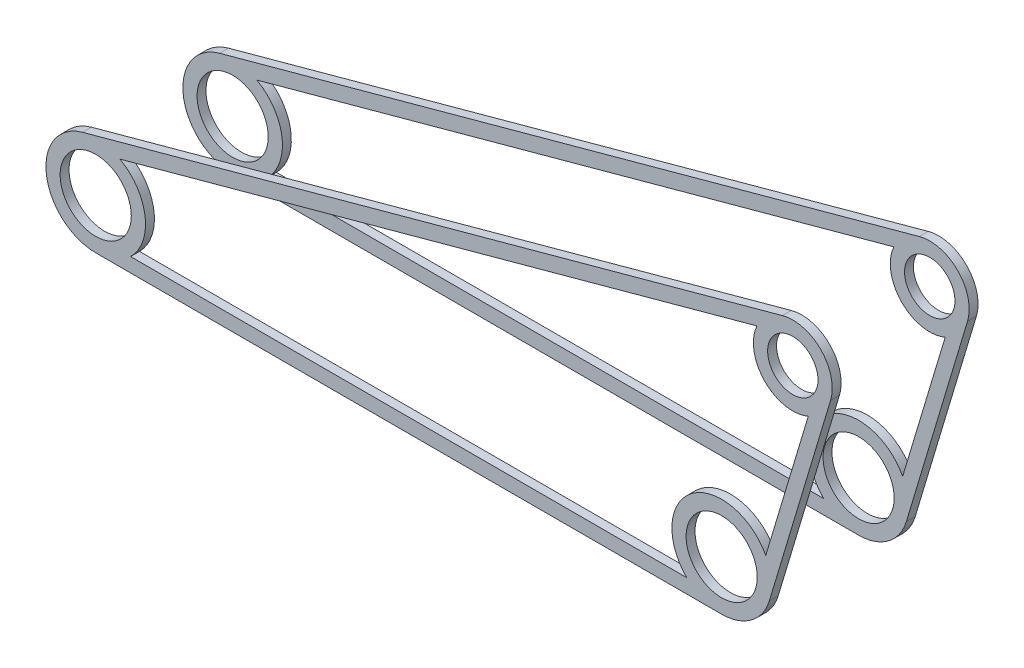
from build123d import *

# Parameters (mm, degrees)
BOSS_EXTRUDE1_START = 11.43
SKETCH1_R           = 6.35
SKETCH1_R_2         = 4.5
BOSS_EXTRUDE1_DEPTH = 1.5875
BOSS_EXTRUDE2_START = -11.43
SKETCH1_4_R         = 6.35
SKETCH1_4_R_2       = 4.5
BOSS_EXTRUDE2_DEPTH = 1.5875


with BuildPart() as part:
    # Sketch1 → Boss-Extrude1 (new body)
    with BuildSketch(Plane.XY.offset(BOSS_EXTRUDE1_START)):
        with BuildLine():
            ThreePointArc((-2.342935012, 8.57570729), (-8.81107649, -1.181960699), (0, -8.89))
            Line((0, -8.89), (111.76, -8.89))
            ThreePointArc((111.76, -8.89), (117.067409275, -7.13186559), (120.275574708, -2.55285867))
            Line((120.275574708, -2.55285867), (131.203492232, 33.899413119))
            ThreePointArc((131.203492232, 33.899413119), (129.498794349, 40.837542714), (122.604627392, 42.712135769))
            Line((122.604627392, 42.712135769), (-2.342935012, 8.57570729))
        make_face()
        Circle(SKETCH1_R, mode=Mode.SUBTRACT)
        with BuildLine():
            Line((4.328219862, 7.765218144), (118.051423128, 38.835083935))
            ThreePointArc((118.051423128, 38.835083935), (119.421205651, 31.004506254), (127.215777419, 29.442807845))
            Line((127.215777419, 29.442807845), (119.629182256, 4.13619035))
            ThreePointArc((119.629182256, 4.13619035), (106.452590725, 7.13186559), (105.538296053, -6.35))
            Line((105.538296053, -6.35), (6.221703947, -6.35))
            ThreePointArc((6.221703947, -6.35), (8.81107649, 1.181960699), (4.328219862, 7.765218144))
        make_face(mode=Mode.SUBTRACT)
        with Locations((124.46, 35.921024484)):
            Circle(SKETCH1_R_2, mode=Mode.SUBTRACT)
        with Locations((111.76, 0)):
            Circle(SKETCH1_R, mode=Mode.SUBTRACT)
    extrude(amount=BOSS_EXTRUDE1_DEPTH)


with BuildPart() as body_2:
    # Sketch1<4> → Boss-Extrude2 (new body)
    with BuildSketch(Plane.XY.offset(BOSS_EXTRUDE2_START)):
        with BuildLine():
            ThreePointArc((-2.342935012, 8.57570729), (-8.81107649, -1.181960699), (0, -8.89))
            Line((0, -8.89), (111.76, -8.89))
            ThreePointArc((111.76, -8.89), (117.067409275, -7.13186559), (120.275574708, -2.55285867))
            Line((120.275574708, -2.55285867), (131.203492232, 33.899413119))
            ThreePointArc((131.203492232, 33.899413119), (129.498794349, 40.837542714), (122.604627392, 42.712135769))
            Line((122.604627392, 42.712135769), (-2.342935012, 8.57570729))
        make_face()
        Circle(SKETCH1_4_R, mode=Mode.SUBTRACT)
        with BuildLine():
            Line((4.328219862, 7.765218144), (118.051423128, 38.835083935))
            ThreePointArc((118.051423128, 38.835083935), (119.421205651, 31.004506254), (127.215777419, 29.442807845))
            Line((127.215777419, 29.442807845), (119.629182256, 4.13619035))
            ThreePointArc((119.629182256, 4.13619035), (106.452590725, 7.13186559), (105.538296053, -6.35))
            Line((105.538296053, -6.35), (6.221703947, -6.35))
            ThreePointArc((6.221703947, -6.35), (8.81107649, 1.181960699), (4.328219862, 7.765218144))
        make_face(mode=Mode.SUBTRACT)
        with Locations((124.46, 35.921024484)):
            Circle(SKETCH1_4_R_2, mode=Mode.SUBTRACT)
        with Locations((111.76, 0)):
            Circle(SKETCH1_4_R, mode=Mode.SUBTRACT)
    extrude(amount=-BOSS_EXTRUDE2_DEPTH)


solid = Compound([part.part, body_2.part])
